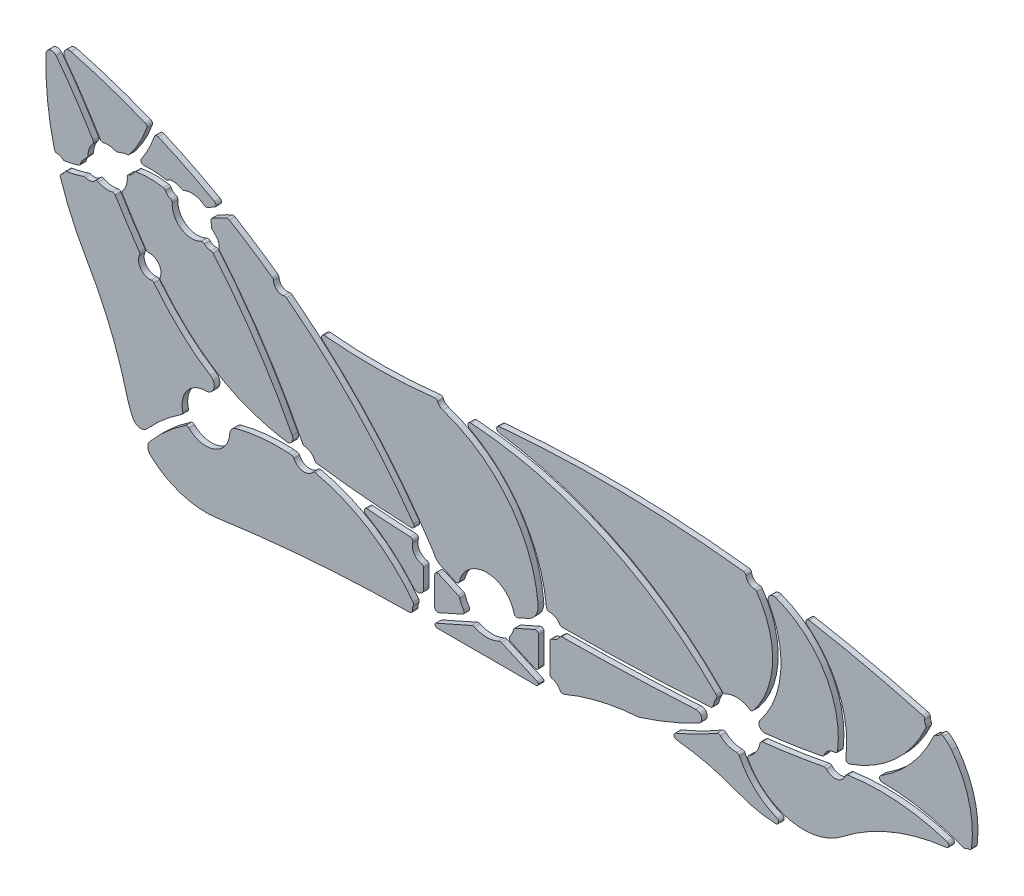
from build123d import *

# Parameters (mm, degrees)
EXTRUDE_1_DEPTH    = 2
EXTRUDE_1_2_DEPTH  = 2
EXTRUDE_1_3_DEPTH  = 2
EXTRUDE_1_4_DEPTH  = 2
EXTRUDE_1_5_DEPTH  = 2
EXTRUDE_1_6_DEPTH  = 2
EXTRUDE_1_7_DEPTH  = 2
EXTRUDE_1_8_DEPTH  = 2
EXTRUDE_1_9_DEPTH  = 2
EXTRUDE_1_10_DEPTH = 2
EXTRUDE_1_11_DEPTH = 2
EXTRUDE_1_12_DEPTH = 2
EXTRUDE_1_13_DEPTH = 2
EXTRUDE_1_14_DEPTH = 2
EXTRUDE_1_15_DEPTH = 2
EXTRUDE_1_16_DEPTH = 2
EXTRUDE_1_17_DEPTH = 2
EXTRUDE_1_18_DEPTH = 2
EXTRUDE_1_19_DEPTH = 2
EXTRUDE_1_20_DEPTH = 2


with BuildPart() as part:
    # ｽｹｯﾁ1 → ﾎﾞｽ - 押し出し1 (new body)
    with BuildSketch(Plane.XY):
        with BuildLine():
            Line((22.5, 0.101020514), (22.5, -10.101020514))
            ThreePointArc((22.5, -10.101020514), (22.725403331, -10.733476046), (23.3, -11.080816412))
            ThreePointArc((23.3, -11.080816412), (24.990478153, -11.869901188), (26.139219533, -13.339855069))
            ThreePointArc((26.139219533, -13.339855069), (26.685177052, -13.856277421), (27.436621612, -13.846647678))
            ThreePointArc((27.436621612, -13.846647678), (40.48832194, -9.598088167), (54.063947757, -7.573360277))
            ThreePointArc((54.063947757, -7.573360277), (54.184018837, -7.558239038), (54.301384043, -7.528724215))
            ThreePointArc((54.301384043, -7.528724215), (65.082931287, -3.594550625), (75.487010068, 1.250511558))
            ThreePointArc((75.487010068, 1.250511558), (76.493832753, 3.556551996), (74.448487112, 5.022183474))
            ThreePointArc((74.448487112, 5.022183474), (50.650061214, 3.946700568), (26.831338926, 3.510572931))
            ThreePointArc((26.831338926, 3.510572931), (26.333052589, 3.374773249), (25.968976767, 3.008467879))
            ThreePointArc((25.968976767, 3.008467879), (24.842007836, 1.757316035), (23.3, 1.080816412))
            ThreePointArc((23.3, 1.080816412), (22.725403331, 0.733476046), (22.5, 0.101020514))
        make_face()
    extrude(amount=-EXTRUDE_1_DEPTH)


with BuildPart() as body_2:
    # ｽｹｯﾁ1 → Extrude 1 2 (new body)
    with BuildSketch(Plane.XY):
        with BuildLine():
            Line((-22.5, -6.412581397), (-22.5, 0.101020514))
            ThreePointArc((-22.5, 0.101020514), (-22.725403331, 0.733476046), (-23.3, 1.080816412))
            ThreePointArc((-23.3, 1.080816412), (-25.924769368, 2.933371156), (-26.340268538, 6.119078888))
            ThreePointArc((-26.340268538, 6.119078888), (-26.488503415, 6.982739341), (-27.260130447, 7.398040053))
            ThreePointArc((-27.260130447, 7.398040053), (-34.893320679, 7.7891821), (-42.516080074, 8.347863062))
            ThreePointArc((-42.516080074, 8.347863062), (-43.555392432, 7.64713656), (-43.093796505, 6.481753786))
            ThreePointArc((-43.093796505, 6.481753786), (-33.93186129, 0.147888894), (-26.029417775, -7.701333223))
            ThreePointArc((-26.029417775, -7.701333223), (-23.81401004, -8.291255869), (-22.5, -6.412581397))
        make_face()
    extrude(amount=-EXTRUDE_1_2_DEPTH)


with BuildPart() as body_3:
    # ｽｹｯﾁ1 → Extrude 1 3 (new body)
    with BuildSketch(Plane.XY):
        with BuildLine():
            Line((-17.093861534, -10.955795493), (-8.626043939, -7.192321006))
            ThreePointArc((-8.626043939, -7.192321006), (-8.06909808, -6.547709353), (-8.211074914, -5.70773587))
            ThreePointArc((-8.211074914, -5.70773587), (-9.032200451, -4.291777604), (-9.611336633, -2.760834679))
            ThreePointArc((-9.611336633, -2.760834679), (-9.818127838, -2.380437031), (-10.166331831, -2.123106598))
            Line((-10.166331831, -2.123106598), (-17.093861534, 0.955795493))
            ThreePointArc((-17.093861534, 0.955795493), (-18.044913541, 0.880476182), (-18.5, 0.041983944))
            Line((-18.5, 0.041983944), (-18.5, -10.041983944))
            ThreePointArc((-18.5, -10.041983944), (-18.044913541, -10.880476182), (-17.093861534, -10.955795493))
        make_face()
    extrude(amount=-EXTRUDE_1_3_DEPTH)


with BuildPart() as body_4:
    # ｽｹｯﾁ1 → Extrude 1 4 (new body)
    with BuildSketch(Plane.XY):
        with BuildLine():
            Line((8.626043939, -7.192321006), (17.093861534, -10.955795493))
            ThreePointArc((17.093861534, -10.955795493), (18.044913541, -10.880476182), (18.5, -10.041983944))
            Line((18.5, -10.041983944), (18.5, 0.041983944))
            ThreePointArc((18.5, 0.041983944), (18.044913541, 0.880476182), (17.093861534, 0.955795493))
            Line((17.093861534, 0.955795493), (10.166331831, -2.123106598))
            ThreePointArc((10.166331831, -2.123106598), (9.818127838, -2.380437031), (9.611336633, -2.760834679))
            ThreePointArc((9.611336633, -2.760834679), (9.032200451, -4.291777604), (8.211074914, -5.70773587))
            ThreePointArc((8.211074914, -5.70773587), (8.06909808, -6.547709353), (8.626043939, -7.192321006))
        make_face()
    extrude(amount=-EXTRUDE_1_4_DEPTH)


with BuildPart() as body_5:
    # ｽｹｯﾁ1 → Extrude 1 5 (new body)
    with BuildSketch(Plane.XY):
        with BuildLine():
            Line((11.118968747, 1.583240188), (14.780704116, 3.210678129))
            ThreePointArc((14.780704116, 3.210678129), (17.508416253, 5.639452419), (18.322470408, 9.199884119))
            ThreePointArc((18.322470408, 9.199884119), (7.814521193, 35.812462193), (-15.610951372, 52.240899233))
            ThreePointArc((-15.610951372, 52.240899233), (-16.726416816, 52.906959729), (-17.45567904, 53.982169639))
            ThreePointArc((-17.45567904, 53.982169639), (-17.871800431, 54.471525722), (-18.499758812, 54.606783477))
            ThreePointArc((-18.499758812, 54.606783477), (-38.112812762, 53.374184357), (-57.747756386, 54.186695724))
            ThreePointArc((-57.747756386, 54.186695724), (-58.759792741, 53.585885084), (-58.499178516, 52.438160712))
            ThreePointArc((-58.499178516, 52.438160712), (-37.276714505, 31.160374537), (-19.152035998, 7.188866612))
            ThreePointArc((-19.152035998, 7.188866612), (-18.959270279, 6.860976368), (-18.798519535, 6.516259335))
            ThreePointArc((-18.798519535, 6.516259335), (-17.758858971, 4.928471706), (-16.202361285, 3.84252576))
            Line((-16.202361285, 3.84252576), (-11.118968747, 1.583240188))
            ThreePointArc((-11.118968747, 1.583240188), (-10.267282975, 1.601793339), (-9.738936619, 2.270047033))
            ThreePointArc((-9.738936619, 2.270047033), (0, 10), (9.738936619, 2.270047033))
            ThreePointArc((9.738936619, 2.270047033), (10.267282975, 1.601793339), (11.118968747, 1.583240188))
        make_face()
    extrude(amount=-EXTRUDE_1_5_DEPTH)


with BuildPart() as body_6:
    # ｽｹｯﾁ1 → Extrude 1 6 (new body)
    with BuildSketch(Plane.XY):
        with BuildLine():
            Line((-17.5, -16), (17.5, -16))
            ThreePointArc((17.5, -16), (18.127636647, -15.778506416), (18.477238313, -15.212144479))
            ThreePointArc((18.477238313, -15.212144479), (18.268989106, -14.854674582), (17.933872224, -14.612086178))
            Line((17.933872224, -14.612086178), (5.236576226, -8.968843512))
            ThreePointArc((5.236576226, -8.968843512), (4.812235497, -8.882820735), (4.391307055, -8.984231873))
            ThreePointArc((4.391307055, -8.984231873), (0, -10), (-4.391307055, -8.984231873))
            ThreePointArc((-4.391307055, -8.984231873), (-4.812235497, -8.882820735), (-5.236576226, -8.968843512))
            Line((-5.236576226, -8.968843512), (-17.933872224, -14.612086178))
            ThreePointArc((-17.933872224, -14.612086178), (-18.268989106, -14.854674582), (-18.477238313, -15.212144479))
            ThreePointArc((-18.477238313, -15.212144479), (-18.127636647, -15.778506416), (-17.5, -16))
        make_face()
    extrude(amount=-EXTRUDE_1_6_DEPTH)


with BuildPart() as body_7:
    # ｽｹｯﾁ1 → Extrude 1 7 (new body)
    with BuildSketch(Plane.XY):
        with BuildLine():
            ThreePointArc((83.211270872, 1.275804061), (85.918070339, -0.421597665), (89.060304278, -0.999786079))
            ThreePointArc((89.060304278, -0.999786079), (89.595121172, -1.150343934), (89.967031901, -1.563114074))
            ThreePointArc((89.967031901, -1.563114074), (95.498956322, -9.057744291), (103.356558634, -14.060718986))
            ThreePointArc((103.356558634, -14.060718986), (103.962078134, -15.191111022), (102.957342201, -15.987945839))
            ThreePointArc((102.957342201, -15.987945839), (96.419112305, -15.235486438), (90.117629525, -13.336549869))
            ThreePointArc((90.117629525, -13.336549869), (79.072499433, -9.782229594), (67.637822736, -7.813407558))
            ThreePointArc((67.637822736, -7.813407558), (66.749100435, -6.968649503), (67.34675765, -5.898019149))
            ThreePointArc((67.34675765, -5.898019149), (74.799057097, -2.464433401), (82.031739222, 1.410432715))
            ThreePointArc((82.031739222, 1.410432715), (82.64364503, 1.537095003), (83.211270872, 1.275804061))
        make_face()
    extrude(amount=-EXTRUDE_1_7_DEPTH)


with BuildPart() as body_8:
    # ｽｹｯﾁ1 → Extrude 1 8 (new body)
    with BuildSketch(Plane.XY):
        with BuildLine():
            ThreePointArc((163.920291551, 8.977503239), (146.403950854, 12.457005785), (128.557163274, 11.807927609))
            ThreePointArc((128.557163274, 11.807927609), (128.07237572, 11.59059704), (127.76731798, 11.155635749))
            ThreePointArc((127.76731798, 11.155635749), (124.75804267, 8.572485352), (121.003592282, 9.850180989))
            ThreePointArc((121.003592282, 9.850180989), (120.575847385, 10.134684344), (120.063293842, 10.169278015))
            ThreePointArc((120.063293842, 10.169278015), (109.189695688, 8.283956274), (98.247377431, 6.850343342))
            ThreePointArc((98.247377431, 6.850343342), (97.672725088, 6.585818326), (97.371810397, 6.029357053))
            ThreePointArc((97.371810397, 6.029357053), (96.028031748, 2.719124583), (93.442710672, 0.253461386))
            ThreePointArc((93.442710672, 0.253461386), (93.00002742, -0.338132848), (93.084381906, -1.072187697))
            ThreePointArc((93.084381906, -1.072187697), (108.261136719, -12.427077278), (126.720890547, -8.125345919))
            ThreePointArc((126.720890547, -8.125345919), (144.171431804, 2.021447824), (163.725732783, 7.032248826))
            ThreePointArc((163.725732783, 7.032248826), (164.608066794, 7.92635712), (163.920291551, 8.977503239))
        make_face()
    extrude(amount=-EXTRUDE_1_8_DEPTH)


with BuildPart() as body_9:
    # ｽｹｯﾁ1 → Extrude 1 9 (new body)
    with BuildSketch(Plane.XY):
        with BuildLine():
            ThreePointArc((129.217245632, 15.498903244), (145.340870587, 25.04107642), (156.400178828, 40.164437549))
            ThreePointArc((156.400178828, 40.164437549), (156.490114246, 40.616134725), (156.368067103, 41.060232927))
            ThreePointArc((156.368067103, 41.060232927), (156.085215089, 41.790050054), (156.000775173, 42.568194129))
            ThreePointArc((156.000775173, 42.568194129), (155.803951642, 43.187014896), (155.268554706, 43.554477497))
            ThreePointArc((155.268554706, 43.554477497), (135.171119836, 48.606684839), (114.850046871, 52.666941105))
            ThreePointArc((114.850046871, 52.666941105), (113.765093768, 52.089460809), (114.059534107, 50.896183133))
            ThreePointArc((114.059534107, 50.896183133), (125.547381919, 35.580716416), (127.900790598, 16.580831267))
            ThreePointArc((127.900790598, 16.580831267), (128.25649785, 15.67177038), (129.217245632, 15.498903244))
        make_face()
    extrude(amount=-EXTRUDE_1_9_DEPTH)


with BuildPart() as body_10:
    # ｽｹｯﾁ1 → Extrude 1 10 (new body)
    with BuildSketch(Plane.XY):
        with BuildLine():
            ThreePointArc((171.785964151, 10.492355035), (171.155696028, 10.378741184), (170.563904339, 10.133937974))
            ThreePointArc((170.563904339, 10.133937974), (170.14622041, 10.013780427), (169.717010958, 10.08216864))
            ThreePointArc((169.717010958, 10.08216864), (155.581300438, 14.221758305), (140.92626069, 15.699704338))
            ThreePointArc((140.92626069, 15.699704338), (139.972472291, 16.427013854), (140.402865662, 17.546591002))
            ThreePointArc((140.402865662, 17.546591002), (151.384643178, 26.924630489), (159.197974761, 39.069543482))
            ThreePointArc((159.197974761, 39.069543482), (159.454634512, 39.413102568), (159.831599898, 39.617563251))
            ThreePointArc((159.831599898, 39.617563251), (160.648344956, 39.993416886), (161.317043281, 40.594400243))
            ThreePointArc((161.317043281, 40.594400243), (161.947741849, 40.949117243), (162.652608619, 40.785508959))
            ThreePointArc((162.652608619, 40.785508959), (164.259804057, 39.486741818), (165.635293674, 37.944697209))
            ThreePointArc((165.635293674, 37.944697209), (171.77520359, 25.346722117), (172.706566648, 11.363159157))
            ThreePointArc((172.706566648, 11.363159157), (172.401803697, 10.763324084), (171.785964151, 10.492355035))
        make_face()
    extrude(amount=-EXTRUDE_1_10_DEPTH)


with BuildPart() as body_11:
    # ｽｹｯﾁ1 → Extrude 1 11 (new body)
    with BuildSketch(Plane.XY):
        with BuildLine():
            ThreePointArc((93.586754605, 14.6562338), (89.394333262, 15.990848089), (85.096260122, 15.05055064))
            ThreePointArc((85.096260122, 15.05055064), (84.479111763, 14.951393184), (83.923649691, 15.238039629))
            ThreePointArc((83.923649691, 15.238039629), (47.483352354, 41.826061968), (4.422429146, 55.263885244))
            ThreePointArc((4.422429146, 55.263885244), (3.560849299, 56.278744516), (4.470999079, 57.250282757))
            ThreePointArc((4.470999079, 57.250282757), (48.007817114, 58.908356302), (91.48378022, 56.07209741))
            ThreePointArc((91.48378022, 56.07209741), (92.069225942, 55.791149679), (92.358682449, 55.209863819))
            ThreePointArc((92.358682449, 55.209863819), (93.350087626, 53.351369569), (95.318967313, 52.602772294))
            ThreePointArc((95.318967313, 52.602772294), (95.774491653, 52.49062391), (96.128746209, 52.183079777))
            ThreePointArc((96.128746209, 52.183079777), (101.822459182, 33.316779439), (94.900870104, 14.865566457))
            ThreePointArc((94.900870104, 14.865566457), (94.283684874, 14.510594718), (93.586754605, 14.6562338))
        make_face()
    extrude(amount=-EXTRUDE_1_11_DEPTH)


with BuildPart() as body_12:
    # ｽｹｯﾁ1 → Extrude 1 12 (new body)
    with BuildSketch(Plane.XY):
        with BuildLine():
            ThreePointArc((81.667277078, 13.253873919), (41.702064453, 41.277821121), (-5.609573539, 53.284850211))
            ThreePointArc((-5.609573539, 53.284850211), (-6.637189872, 52.564938691), (-6.152522338, 51.407629179))
            ThreePointArc((-6.152522338, 51.407629179), (12.757832942, 34.089272661), (21.271842987, 9.901700598))
            ThreePointArc((21.271842987, 9.901700598), (21.611427135, 9.239911484), (22.314015361, 8.995673875))
            ThreePointArc((22.314015361, 8.995673875), (24.414609558, 8.512017973), (25.959198864, 7.008467879))
            ThreePointArc((25.959198864, 7.008467879), (26.327181142, 6.642729772), (26.828894412, 6.510596833))
            ThreePointArc((26.828894412, 6.510596833), (53.301872163, 7.036667802), (79.74722804, 8.355172349))
            ThreePointArc((79.74722804, 8.355172349), (80.341592557, 8.601026945), (80.663274603, 9.158013769))
            ThreePointArc((80.663274603, 9.158013769), (81.101716083, 10.641195817), (81.801654702, 12.020378853))
            ThreePointArc((81.801654702, 12.020378853), (81.94890883, 12.660487916), (81.667277078, 13.253873919))
        make_face()
    extrude(amount=-EXTRUDE_1_12_DEPTH)


with BuildPart() as body_13:
    # ｽｹｯﾁ1 → Extrude 1 13 (new body)
    with BuildSketch(Plane.XY):
        with BuildLine():
            ThreePointArc((97.424637255, 13.215415929), (97.235079465, 10.997428592), (99.214022424, 9.978024479))
            ThreePointArc((99.214022424, 9.978024479), (109.36232121, 11.345501175), (119.449838366, 13.106171051))
            ThreePointArc((119.449838366, 13.106171051), (119.918131969, 13.335906367), (120.207034495, 13.770201826))
            ThreePointArc((120.207034495, 13.770201826), (121.659362935, 15.743673555), (123.98999328, 16.499987483))
            ThreePointArc((123.98999328, 16.499987483), (124.649769443, 16.750726015), (124.979615741, 17.374725869))
            ThreePointArc((124.979615741, 17.374725869), (120.295248245, 39.392547584), (102.944576602, 53.73416414))
            ThreePointArc((102.944576602, 53.73416414), (100.727848949, 53.158409228), (100.505114473, 50.878987248))
            ThreePointArc((100.505114473, 50.878987248), (104.726719606, 31.575944409), (97.424637255, 13.215415929))
        make_face()
    extrude(amount=-EXTRUDE_1_13_DEPTH)


with BuildPart() as body_14:
    # ｽｹｯﾁ1 → Extrude 1 14 (new body)
    with BuildSketch(Plane.XY):
        with BuildLine():
            ThreePointArc((-92.646482628, 72.972153264), (-95.226633677, 71.724656509), (-97.750631704, 70.36713614))
            ThreePointArc((-97.750631704, 70.36713614), (-98.178932991, 69.886768371), (-98.225822663, 69.244898802))
            ThreePointArc((-98.225822663, 69.244898802), (-98.063053837, 68.418663332), (-98.000680849, 67.578860765))
            ThreePointArc((-98.000680849, 67.578860765), (-97.921285564, 67.202082756), (-97.705410986, 66.8832357))
            ThreePointArc((-97.705410986, 66.8832357), (-96.845691965, 65.995488705), (-96.021295968, 65.074846127))
            ThreePointArc((-96.021295968, 65.074846127), (-95.395423067, 63.8877696), (-95.349720401, 62.546583993))
            ThreePointArc((-95.349720401, 62.546583993), (-95.336157636, 62.105899259), (-95.134397943, 61.713878839))
            ThreePointArc((-95.134397943, 61.713878839), (-79.093035157, 40.212538503), (-65.583431059, 17.036612343))
            ThreePointArc((-65.583431059, 17.036612343), (-65.240913382, 16.654395429), (-64.753909299, 16.492422744))
            ThreePointArc((-64.753909299, 16.492422744), (-62.655797065, 15.741097437), (-61.285349547, 13.983702131))
            ThreePointArc((-61.285349547, 13.983702131), (-60.972999003, 13.567125642), (-60.493566976, 13.364040033))
            ThreePointArc((-60.493566976, 13.364040033), (-43.722386211, 11.463371837), (-26.878319095, 10.385203561))
            ThreePointArc((-26.878319095, 10.385203561), (-25.960207207, 10.906984019), (-26.021967296, 11.961199356))
            ThreePointArc((-26.021967296, 11.961199356), (-46.898048291, 37.235706645), (-71.343129401, 59.077169187))
            ThreePointArc((-71.343129401, 59.077169187), (-71.750387624, 59.262904595), (-72.197875937, 59.252363596))
            ThreePointArc((-72.197875937, 59.252363596), (-74.72769572, 59.751974852), (-75.935182614, 62.030477638))
            ThreePointArc((-75.935182614, 62.030477638), (-76.054051204, 62.462018089), (-76.349274765, 62.798470094))
            ThreePointArc((-76.349274765, 62.798470094), (-83.925565639, 68.022389418), (-91.716533423, 72.920382631))
            ThreePointArc((-91.716533423, 72.920382631), (-92.1751128, 73.061144555), (-92.646482628, 72.972153264))
        make_face()
    extrude(amount=-EXTRUDE_1_14_DEPTH)


with BuildPart() as body_15:
    # ｽｹｯﾁ1 → Extrude 1 15 (new body)
    with BuildSketch(Plane.XY):
        with BuildLine():
            ThreePointArc((-150.204030248, 61.786911622), (-147.74564025, 62.291578487), (-145.326579343, 62.959795782))
            ThreePointArc((-145.326579343, 62.959795782), (-144.882580356, 63.24428851), (-144.645024595, 63.715073466))
            ThreePointArc((-144.645024595, 63.715073466), (-144.399069128, 64.437692205), (-143.978704032, 65.074846127))
            ThreePointArc((-143.978704032, 65.074846127), (-143.154308035, 65.995488705), (-142.294589014, 66.8832357))
            ThreePointArc((-142.294589014, 66.8832357), (-142.078714436, 67.202082756), (-141.999319151, 67.578860765))
            ThreePointArc((-141.999319151, 67.578860765), (-141.541391212, 69.973259259), (-140.290107039, 72.065418448))
            ThreePointArc((-140.290107039, 72.065418448), (-140.049175029, 72.638658646), (-140.193604771, 73.243466556))
            add(Edge.make_bspline(
                [(-140.193604771, 73.243466556), (-142.662709259, 77.265624584), (-146.632325719, 83.554101552), (-151.178150553, 89.893311674), (-153.095880556, 92.376364737), (-153.379218954, 92.739061626)],
                knots=[0.052564215, 0.052564215, 0.052564215, 0.052564215, 0.1615119, 0.225004149, 0.235932182, 0.235932182, 0.235932182, 0.235932182], degree=3))
            ThreePointArc((-153.379218954, 92.739061626), (-155.578419613, 93.408278907), (-156.954436011, 91.566835403))
            ThreePointArc((-156.954436011, 91.566835403), (-156.41516979, 77.430832536), (-153.974336047, 63.496711978))
            ThreePointArc((-153.974336047, 63.496711978), (-153.617445554, 62.946282157), (-152.996239059, 62.735459239))
            ThreePointArc((-152.996239059, 62.735459239), (-151.944301544, 62.552841011), (-151.022937008, 62.013388192))
            ThreePointArc((-151.022937008, 62.013388192), (-150.638732608, 61.80885322), (-150.204030248, 61.786911622))
        make_face()
    extrude(amount=-EXTRUDE_1_15_DEPTH)


with BuildPart() as body_16:
    # ｽｹｯﾁ1 → Extrude 1 16 (new body)
    with BuildSketch(Plane.XY):
        with BuildLine():
            ThreePointArc((-122.987570022, 76.057235981), (-120.363163566, 80.53748433), (-118.334402634, 85.317051632))
            ThreePointArc((-118.334402634, 85.317051632), (-117.791441284, 85.902420306), (-116.993029265, 85.9037473))
            ThreePointArc((-116.993029265, 85.9037473), (-106.841656639, 81.189233057), (-96.946878275, 75.957562975))
            ThreePointArc((-96.946878275, 75.957562975), (-96.437083464, 75.068877577), (-96.976789503, 74.198033231))
            ThreePointArc((-96.976789503, 74.198033231), (-98.233931235, 73.530059693), (-99.477126101, 72.836474436))
            ThreePointArc((-99.477126101, 72.836474436), (-100.053312977, 72.707932638), (-100.601598753, 72.926786512))
            ThreePointArc((-100.601598753, 72.926786512), (-104.035554327, 74.414473762), (-107.745169421, 73.920489866))
            ThreePointArc((-107.745169421, 73.920489866), (-108.121822546, 73.840504228), (-108.50077585, 73.908766026))
            ThreePointArc((-108.50077585, 73.908766026), (-109.660624664, 74.335336357), (-110.836246698, 74.71628826))
            ThreePointArc((-110.836246698, 74.71628826), (-112.244264312, 74.796025008), (-113.533139444, 74.223598206))
            ThreePointArc((-113.533139444, 74.223598206), (-113.911582503, 74.043529717), (-114.330580957, 74.03435888))
            ThreePointArc((-114.330580957, 74.03435888), (-118.195023505, 74.518282292), (-122.089604161, 74.499854314))
            ThreePointArc((-122.089604161, 74.499854314), (-123.025245698, 74.997944172), (-122.987570022, 76.057235981))
        make_face()
    extrude(amount=-EXTRUDE_1_16_DEPTH)


with BuildPart() as body_17:
    # ｽｹｯﾁ1 → Extrude 1 17 (new body)
    with BuildSketch(Plane.XY):
        with BuildLine():
            ThreePointArc((-106.070500124, 1.550291751), (-97.009254914, -0.45647182), (-91.513444146, 7.022119544))
            ThreePointArc((-91.513444146, 7.022119544), (-90.839066816, 8.754383733), (-89.273595206, 9.756792154))
            ThreePointArc((-89.273595206, 9.756792154), (-80.019916987, 11.403269411), (-70.622630554, 11.583423887))
            ThreePointArc((-70.622630554, 11.583423887), (-70.583711328, 11.580350271), (-70.544941735, 11.575759866))
            ThreePointArc((-70.544941735, 11.575759866), (-69.988622797, 11.500845732), (-69.431789827, 11.42985325))
            ThreePointArc((-69.431789827, 11.42985325), (-68.962039058, 11.242849396), (-68.643809813, 10.849954531))
            ThreePointArc((-68.643809813, 10.849954531), (-65.565782035, 8.540215828), (-61.964082393, 9.895541461))
            ThreePointArc((-61.964082393, 9.895541461), (-61.519642672, 10.193671151), (-60.985116277, 10.219929694))
            ThreePointArc((-60.985116277, 10.219929694), (-41.602155025, 2.06939678), (-26.224992097, -12.271915363))
            ThreePointArc((-26.224992097, -12.271915363), (-26.029919562, -12.770267331), (-26.119760126, -13.297843535))
            ThreePointArc((-26.119760126, -13.297843535), (-26.405864749, -14.137317809), (-26.499953909, -15.019202234))
            ThreePointArc((-26.499953909, -15.019202234), (-26.787762201, -15.725999505), (-27.49034138, -16.023956702))
            ThreePointArc((-27.49034138, -16.023956702), (-61.783072383, -17.486582136), (-95.904497639, -21.209351445))
            ThreePointArc((-95.904497639, -21.209351445), (-108.674407076, -20.172272438), (-119.751248422, -13.734127855))
            ThreePointArc((-119.751248422, -13.734127855), (-120.70255746, -11.718381768), (-120.000805926, -9.602781154))
            ThreePointArc((-120.000805926, -9.602781154), (-114.070402793, -3.50960152), (-107.337748418, 1.683459661))
            ThreePointArc((-107.337748418, 1.683459661), (-106.680167747, 1.84485003), (-106.070500124, 1.550291751))
        make_face()
    extrude(amount=-EXTRUDE_1_17_DEPTH)


with BuildPart() as body_18:
    # ｽｹｯﾁ1 → Extrude 1 18 (new body)
    with BuildSketch(Plane.XY):
        with BuildLine():
            ThreePointArc((-100.50788434, 61.092108441), (-99.463987015, 60.354774164), (-98.207911317, 60.118856168))
            ThreePointArc((-98.207911317, 60.118856168), (-97.769172649, 60.031474199), (-97.41243615, 59.761536619))
            ThreePointArc((-97.41243615, 59.761536619), (-82.193170883, 39.457032189), (-69.261228652, 17.624400522))
            ThreePointArc((-69.261228652, 17.624400522), (-69.408595319, 15.535576449), (-71.338576405, 14.723125866))
            add(Edge.make_bspline(
                [(-116.138557125, 41.949479301), (-114.243099846, 39.582361655), (-110.603655016, 35.387496388), (-104.793066389, 29.848176401), (-98.797191115, 25.20892396), (-92.187253455, 21.228406158), (-86.087221005, 18.527327471), (-80.801301838, 16.778082915), (-76.622725698, 15.683185636), (-73.411353361, 15.051902865), (-71.618553207, 14.766159876), (-71.338576405, 14.723125866)],
                knots=[0.541717275, 0.541717275, 0.541717275, 0.541717275, 0.614546681, 0.676001349, 0.737456018, 0.798910686, 0.860365354, 0.891092688, 0.921820022, 0.952547356, 0.95819775, 0.95819775, 0.95819775, 0.95819775], degree=3))
            ThreePointArc((-116.138557125, 41.949479301), (-116.347150516, 42.427811745), (-116.286377614, 42.946097174))
            ThreePointArc((-116.286377614, 42.946097174), (-116.79621958, 46.827321778), (-120.374450859, 48.414805377))
            ThreePointArc((-120.374450859, 48.414805377), (-120.8870616, 48.502426921), (-121.286355454, 48.835611143))
            add(Edge.make_bspline(
                [(-129.726535324, 61.811005118), (-129.363824349, 61.221580452), (-126.626262094, 56.792702191), (-123.828577976, 52.454729918), (-121.286355454, 48.835611143)],
                knots=[0.352703594, 0.352703594, 0.352703594, 0.352703594, 0.368728009, 0.473383408, 0.473383408, 0.473383408, 0.473383408], degree=3))
            ThreePointArc((-129.726535324, 61.811005118), (-129.872165081, 62.408582882), (-129.640510667, 62.978357787))
            ThreePointArc((-129.640510667, 62.978357787), (-128.341382454, 65.321877149), (-128.017920694, 67.981800007))
            ThreePointArc((-128.017920694, 67.981800007), (-127.852816871, 68.607581037), (-127.339079784, 69.00119935))
            ThreePointArc((-127.339079784, 69.00119935), (-126.29654459, 69.60730952), (-125.576906384, 70.574971663))
            ThreePointArc((-125.576906384, 70.574971663), (-125.281409422, 70.943694366), (-124.849604668, 71.135578553))
            ThreePointArc((-124.849604668, 71.135578553), (-120, 71.572377608), (-115.150395332, 71.135578553))
            ThreePointArc((-115.150395332, 71.135578553), (-114.718590578, 70.943694366), (-114.423093616, 70.574971663))
            ThreePointArc((-114.423093616, 70.574971663), (-113.70345541, 69.60730952), (-112.660920216, 69.00119935))
            ThreePointArc((-112.660920216, 69.00119935), (-112.147183129, 68.607581037), (-111.982079306, 67.981800007))
            ThreePointArc((-111.982079306, 67.981800007), (-108.818181818, 61.614248932), (-101.714859342, 61.299981825))
            ThreePointArc((-101.714859342, 61.299981825), (-101.075825626, 61.402437082), (-100.50788434, 61.092108441))
        make_face()
    extrude(amount=-EXTRUDE_1_18_DEPTH)


with BuildPart() as body_19:
    # ｽｹｯﾁ1 → Extrude 1 19 (new body)
    with BuildSketch(Plane.XY):
        with BuildLine():
            ThreePointArc((-148.087106017, 96.662191007), (-150.26052062, 95.836591736), (-150.184458047, 93.512896473))
            add(Edge.make_bspline(
                [(-150.184458047, 93.512896473), (-148.610251347, 91.454833101), (-144.226620842, 85.365558079), (-140.189360458, 78.974100999), (-137.60504663, 74.763737822)],
                knots=[0.062931473, 0.062931473, 0.062931473, 0.062931473, 0.122909336, 0.236323164, 0.236323164, 0.236323164, 0.236323164], degree=3))
            ThreePointArc((-137.60504663, 74.763737822), (-137.141928659, 74.365677043), (-136.533687257, 74.31115149))
            ThreePointArc((-136.533687257, 74.31115149), (-134.363543886, 74.452237694), (-132.254830579, 73.920489866))
            ThreePointArc((-132.254830579, 73.920489866), (-131.878177454, 73.840504228), (-131.49922415, 73.908766026))
            ThreePointArc((-131.49922415, 73.908766026), (-130.339375336, 74.335336357), (-129.163753302, 74.71628826))
            ThreePointArc((-129.163753302, 74.71628826), (-128.667281007, 74.821664241), (-128.160150137, 74.841841395))
            ThreePointArc((-128.160150137, 74.841841395), (-127.703850215, 74.929373539), (-127.336357893, 75.213663689))
            ThreePointArc((-127.336357893, 75.213663689), (-123.702181112, 80.633649045), (-121.064206489, 86.602281387))
            ThreePointArc((-121.064206489, 86.602281387), (-121.100824658, 87.340386295), (-121.634308586, 87.851790875))
            ThreePointArc((-121.634308586, 87.851790875), (-134.719059574, 92.682281347), (-148.087106017, 96.662191007))
        make_face()
    extrude(amount=-EXTRUDE_1_19_DEPTH)


with BuildPart() as body_20:
    # ｽｹｯﾁ1 → Extrude 1 20 (new body)
    with BuildSketch(Plane.XY):
        with BuildLine():
            ThreePointArc((-151.836934791, 56.014102551), (-147.745407286, 45.4518558), (-142.536293001, 35.39368588))
            ThreePointArc((-142.536293001, 35.39368588), (-134.07925039, 18.380808166), (-128.103750797, 0.346036683))
            ThreePointArc((-128.103750797, 0.346036683), (-127.166359581, -2.648345044), (-125.910949972, -5.523926887))
            ThreePointArc((-125.910949972, -5.523926887), (-123.628983467, -7.150042408), (-120.99938497, -6.182140264))
            ThreePointArc((-120.99938497, -6.182140264), (-115.180555638, -0.495167069), (-108.676920035, 4.393919026))
            ThreePointArc((-108.676920035, 4.393919026), (-108.294327864, 4.864318046), (-108.253865555, 5.469309624))
            ThreePointArc((-108.253865555, 5.469309624), (-106.691238149, 12.741882489), (-100.004176204, 15.999998974))
            ThreePointArc((-100.004176204, 15.999998974), (-97.124197044, 18.164996845), (-98.400392477, 21.534391592))
            add(Edge.make_bspline(
                [(-98.400392477, 21.534391592), (-100.512298106, 22.872050258), (-104.752896039, 25.906486872), (-111.577205949, 31.985543662), (-116.012249702, 36.988860584), (-118.508117007, 40.107975846)],
                knots=[0.541413424, 0.541413424, 0.541413424, 0.541413424, 0.598722808, 0.662215056, 0.755724115, 0.755724115, 0.755724115, 0.755724115], degree=3))
            ThreePointArc((-118.508117007, 40.107975846), (-118.921135063, 40.413105644), (-119.431132469, 40.473028542))
            ThreePointArc((-119.431132469, 40.473028542), (-123.203726039, 42.037346729), (-123.63652459, 46.098410512))
            ThreePointArc((-123.63652459, 46.098410512), (-123.549837589, 46.606278095), (-123.727484658, 47.089895338))
            add(Edge.make_bspline(
                [(-123.727484658, 47.089895338), (-126.020093768, 50.352205782), (-128.871994413, 54.731171314), (-131.636405935, 59.187788315), (-132.276308752, 60.227499352)],
                knots=[0.352852659, 0.352852659, 0.352852659, 0.352852659, 0.445522593, 0.473623423, 0.473623423, 0.473623423, 0.473623423], degree=3))
            ThreePointArc((-132.276308752, 60.227499352), (-132.746414376, 60.627713277), (-133.361945386, 60.675588736))
            ThreePointArc((-133.361945386, 60.675588736), (-135.880732531, 60.536859212), (-138.285140658, 61.299981825))
            ThreePointArc((-138.285140658, 61.299981825), (-138.924174374, 61.402437082), (-139.49211566, 61.092108441))
            ThreePointArc((-139.49211566, 61.092108441), (-141.061105651, 60.187537156), (-142.864802758, 60.35080242))
            ThreePointArc((-142.864802758, 60.35080242), (-143.215619048, 60.427899087), (-143.571046826, 60.376062231))
            ThreePointArc((-143.571046826, 60.376062231), (-146.562441547, 59.49371431), (-149.612934356, 58.844504131))
            ThreePointArc((-149.612934356, 58.844504131), (-150.029216938, 58.669006172), (-150.325785264, 58.328215988))
            ThreePointArc((-150.325785264, 58.328215988), (-150.789990268, 57.680099045), (-151.40850633, 57.177128133))
            ThreePointArc((-151.40850633, 57.177128133), (-151.824628715, 56.66999307), (-151.836934791, 56.014102551))
        make_face()
    extrude(amount=-EXTRUDE_1_20_DEPTH)


solid = Compound([part.part, body_2.part, body_3.part, body_4.part, body_5.part, body_6.part, body_7.part, body_8.part, body_9.part, body_10.part, body_11.part, body_12.part, body_13.part, body_14.part, body_15.part, body_16.part, body_17.part, body_18.part, body_19.part, body_20.part])
